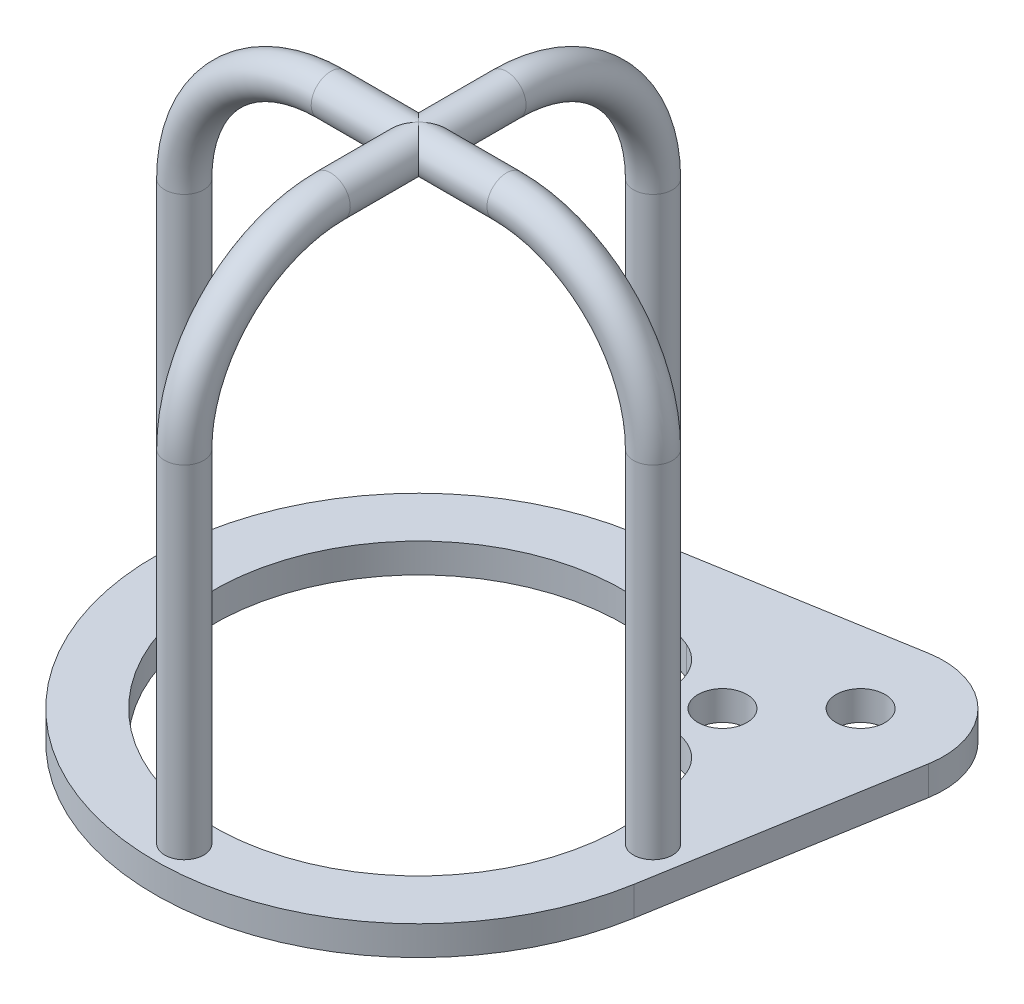
from build123d import *

# Parameters (mm, degrees)
ESQUISSE2_R                  = 2
R_P_TITION_CIRCULAIRE1_COUNT = 4
ESQUISSE4_R                  = 2.5
BOSS_EXTRU_1_DEPTH           = 3
CONG_1_R                     = 5


with BuildPart() as part:
    # Balayage1: sweep along a path in Esquisse1
    with BuildLine(Plane.XY) as balayage1_path:
        Line((0, 50), (9, 50))
        ThreePointArc((9, 50), (19.606601718, 45.606601718), (24, 35))
        Line((24, 35), (24, 0))
    # Esquisse2 → Balayage1 (sweep)
    with BuildSketch(Plane(origin=(0, 0, 0), x_dir=(1, 0, 0), z_dir=(0, 1, 0))):
        with Locations((24, 0)):
            Circle(ESQUISSE2_R)
    balayage1 = sweep(path=balayage1_path.line)

    # Répétition circulaire1: Balayage1 ×4 about axis
    r_p_tition_circulaire1_axis = Axis((0, 0, 0), (0, 1, 0))
    for i in range(1, R_P_TITION_CIRCULAIRE1_COUNT):
        add(balayage1.rotate(r_p_tition_circulaire1_axis, i * 360 / R_P_TITION_CIRCULAIRE1_COUNT))

    # Esquisse4 → Boss.-Extru.1 (add)
    with BuildSketch(Plane.XZ):
        with BuildLine():
            Line((26.615482782, 4.540492957), (31.006365281, -21.198002549))
            ThreePointArc((31.006365281, -21.198002549), (28.637824638, -28.637824638), (21.198002549, -31.006365281))
            Line((21.198002549, -31.006365281), (-4.540492957, -26.615482782))
            ThreePointArc((-4.540492957, -26.615482782), (-19.091883092, 19.091883092), (26.615482782, 4.540492957))
        make_face()
        with Locations((15.556349186, -15.556349186)):
            Circle(ESQUISSE4_R, mode=Mode.SUBTRACT)
        with Locations((22.627416998, -22.627416998)):
            Circle(ESQUISSE4_R, mode=Mode.SUBTRACT)
        with BuildLine():
            ThreePointArc((11.524622524, -17.555143853), (12.374368671, -12.374368671), (17.555143853, -11.524622524))
            ThreePointArc((17.555143853, -11.524622524), (-14.849242405, 14.849242405), (11.524622524, -17.555143853))
        make_face(mode=Mode.SUBTRACT)
    extrude(amount=BOSS_EXTRU_1_DEPTH)

    # Congé1
    cong_1_edges = [part.edges().sort_by_distance(p)[0] for p in [
        (17.555143853, -1.5, -11.524622524),
        (11.524622524, -1.5, -17.555143853),
    ]]
    fillet(cong_1_edges, radius=CONG_1_R)


solid = part.part
